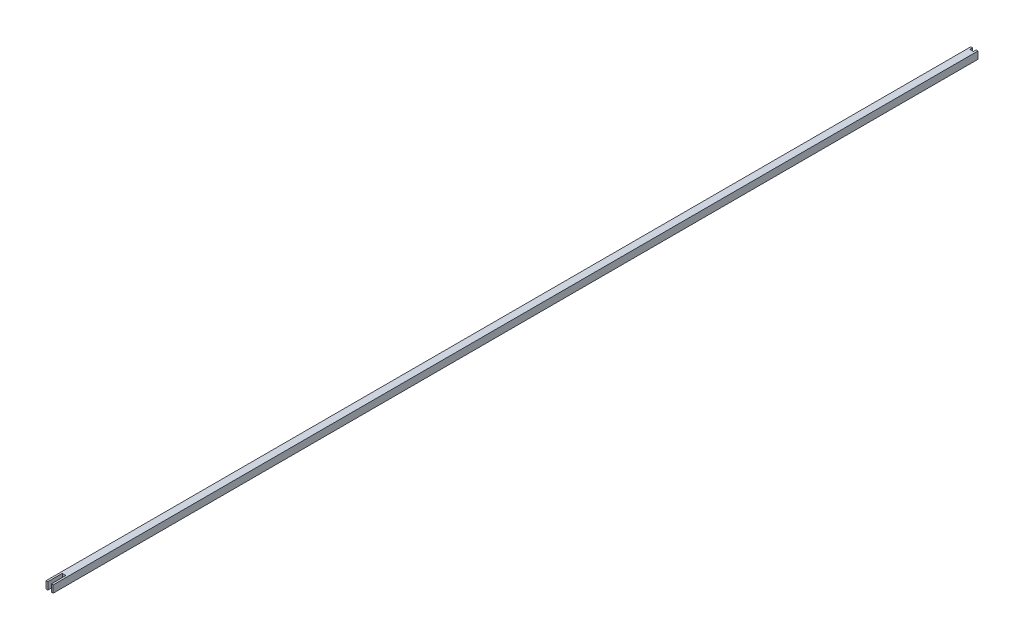
from build123d import *

# Parameters (mm, degrees)
BOSS_EXTRUDE1_DEPTH = 6.35


with BuildPart() as part:
    # Sketch1 → Boss-Extrude1 (new body)
    with BuildSketch(Plane(origin=(0, 0, 0), x_dir=(-1, 0, 0), z_dir=(0, 1, 0))):
        Polygon((0, 0), (1.5875, 0), (1.5875, 2.38125), (4.7625, 2.38125), (4.7625, 0), (6.35, 0), (6.35, 812.8), (4.7625, 812.8), (4.7625, 800.1), (1.5875, 800.1), (1.5875, 812.8), (0, 812.8), align=None)
    extrude(amount=BOSS_EXTRUDE1_DEPTH)


solid = part.part
